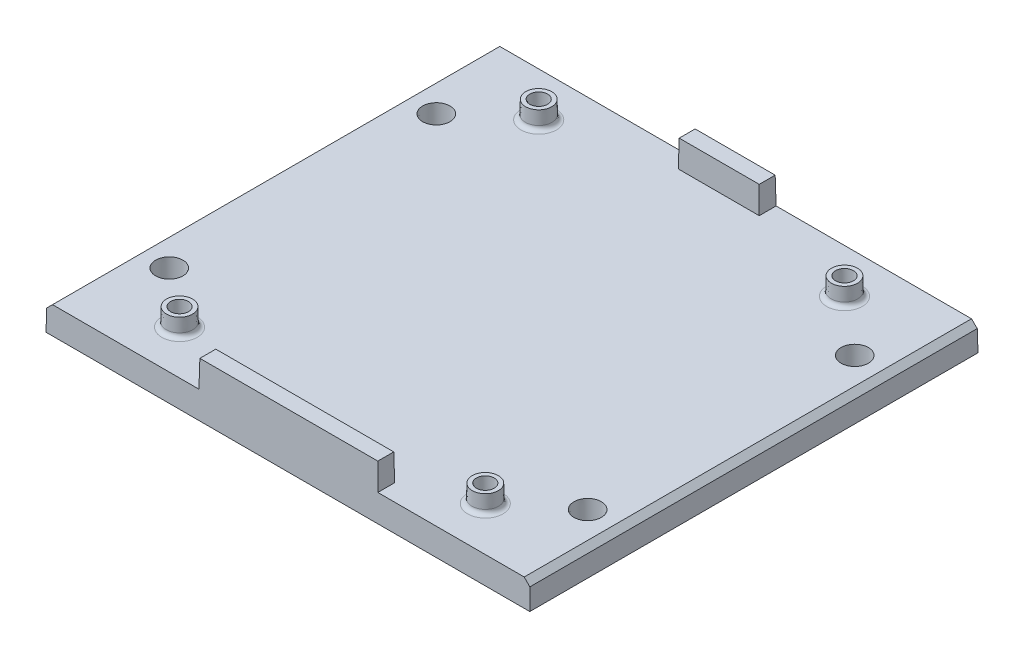
from build123d import *

# Parameters (mm, degrees)
SKETCH1_W                     = 54.349101298
SKETCH1_H                     = 50.349101298
BOSS_EXTRUDE2_DEPTH           = 3
SKETCH7_R                     = 1.53491013
CUT_EXTRUDE1_DEPTH            = 77.127621628
CUT_EXTRUDE1_DRAFT            = -1
CUT_EXTRUDE1_PROFILE_2_DEPTH  = 77.127621628
CUT_EXTRUDE1_PROFILE_2_DRAFT  = -1
CUT_EXTRUDE1_PROFILE_3_DEPTH  = 77.127621628
CUT_EXTRUDE1_PROFILE_3_DRAFT  = -1
CUT_EXTRUDE1_PROFILE_4_DEPTH  = 77.127621628
CUT_EXTRUDE1_PROFILE_4_DRAFT  = -1
SKETCH8_W                     = 20.2
SKETCH8_H                     = 2
SKETCH8_W_2                   = 9.2
BOSS_EXTRUDE3_DEPTH           = 3
FILLET1_SIZE                  = 0.68
SKETCH9_R                     = 1.5
BOSS_EXTRUDE4_DEPTH           = 2
BOSS_EXTRUDE4_DRAFT           = 1
BOSS_EXTRUDE4_PROFILE_2_DEPTH = 2
BOSS_EXTRUDE4_PROFILE_2_DRAFT = 1
BOSS_EXTRUDE4_PROFILE_3_DEPTH = 2
BOSS_EXTRUDE4_PROFILE_3_DRAFT = 1
BOSS_EXTRUDE4_PROFILE_4_DEPTH = 2
BOSS_EXTRUDE4_PROFILE_4_DRAFT = 1
SKETCH10_R                    = 1
CUT_EXTRUDE2_DEPTH            = 3
CUT_EXTRUDE2_DRAFT            = -1
CUT_EXTRUDE2_PROFILE_2_DEPTH  = 3
CUT_EXTRUDE2_PROFILE_2_DRAFT  = -1
CUT_EXTRUDE2_PROFILE_3_DEPTH  = 3
CUT_EXTRUDE2_PROFILE_3_DRAFT  = -1
CUT_EXTRUDE2_PROFILE_4_DEPTH  = 3
CUT_EXTRUDE2_PROFILE_4_DRAFT  = -1
FILLET2_R                     = 0.5
DRAFT1_ANGLE                  = -1


with BuildPart() as part:
    # Sketch1 → Boss-Extrude2 (new body)
    with BuildSketch(Plane(origin=(0, 0, 0), x_dir=(-1, 0, 0), z_dir=(0, -1, 0))):
        with Locations((-30, 25)):
            Rectangle(SKETCH1_W, SKETCH1_H)
    extrude(amount=-BOSS_EXTRUDE2_DEPTH)


with BuildPart() as cut_extrude1_tool:
    # Sketch7 → Cut-Extrude1 (with draft: the straight prism first)
    with BuildSketch(Plane(origin=(0, 3, 0), x_dir=(1, 0, 0), z_dir=(0, 1, 0))):
        with Locations((6.5, 40)):
            Circle(SKETCH7_R)
    extrude(amount=-CUT_EXTRUDE1_DEPTH)
    # Cut-Extrude1: the draft: its side faces are tilted about the plane it starts from
    cut_extrude1_sides = [cut_extrude1_tool.faces().sort_by_distance(p)[0] for p in [
        (4.96508987, -35.563810814, -40),
    ]]
    draft(cut_extrude1_sides, Plane(origin=(0, 3, 0), x_dir=(1, 0, 0), z_dir=(0, 1, 0)), CUT_EXTRUDE1_DRAFT)


with BuildPart() as part_1:
    add(part.part)

    # Cut-Extrude1: cut by cut_extrude1_tool
    add(cut_extrude1_tool.part, mode=Mode.SUBTRACT)


with BuildPart() as cut_extrude1_profile_2_tool:
    # Sketch7 → Cut-Extrude1 profile 2 (with draft: the straight prism first)
    with BuildSketch(Plane(origin=(0, 3, 0), x_dir=(1, 0, 0), z_dir=(0, 1, 0))):
        with Locations((6.5, 10)):
            Circle(SKETCH7_R)
    extrude(amount=-CUT_EXTRUDE1_PROFILE_2_DEPTH)
    # Cut-Extrude1 profile 2: the draft: its side faces are tilted about the plane it starts from
    cut_extrude1_profile_2_sides = [cut_extrude1_profile_2_tool.faces().sort_by_distance(p)[0] for p in [
        (4.96508987, -35.563810814, -10),
    ]]
    draft(cut_extrude1_profile_2_sides, Plane(origin=(0, 3, 0), x_dir=(1, 0, 0), z_dir=(0, 1, 0)), CUT_EXTRUDE1_PROFILE_2_DRAFT)


with BuildPart() as part_2:
    add(part_1.part)

    # Cut-Extrude1 profile 2: cut by cut_extrude1_profile_2_tool
    add(cut_extrude1_profile_2_tool.part, mode=Mode.SUBTRACT)


with BuildPart() as cut_extrude1_profile_3_tool:
    # Sketch7 → Cut-Extrude1 profile 3 (with draft: the straight prism first)
    with BuildSketch(Plane(origin=(0, 3, 0), x_dir=(1, 0, 0), z_dir=(0, 1, 0))):
        with Locations((53.5, 10)):
            Circle(SKETCH7_R)
    extrude(amount=-CUT_EXTRUDE1_PROFILE_3_DEPTH)
    # Cut-Extrude1 profile 3: the draft: its side faces are tilted about the plane it starts from
    cut_extrude1_profile_3_sides = [cut_extrude1_profile_3_tool.faces().sort_by_distance(p)[0] for p in [
        (51.96508987, -35.563810814, -10),
    ]]
    draft(cut_extrude1_profile_3_sides, Plane(origin=(0, 3, 0), x_dir=(1, 0, 0), z_dir=(0, 1, 0)), CUT_EXTRUDE1_PROFILE_3_DRAFT)


with BuildPart() as part_3:
    add(part_2.part)

    # Cut-Extrude1 profile 3: cut by cut_extrude1_profile_3_tool
    add(cut_extrude1_profile_3_tool.part, mode=Mode.SUBTRACT)


with BuildPart() as cut_extrude1_profile_4_tool:
    # Sketch7 → Cut-Extrude1 profile 4 (with draft: the straight prism first)
    with BuildSketch(Plane(origin=(0, 3, 0), x_dir=(1, 0, 0), z_dir=(0, 1, 0))):
        with Locations((53.5, 40)):
            Circle(SKETCH7_R)
    extrude(amount=-CUT_EXTRUDE1_PROFILE_4_DEPTH)
    # Cut-Extrude1 profile 4: the draft: its side faces are tilted about the plane it starts from
    cut_extrude1_profile_4_sides = [cut_extrude1_profile_4_tool.faces().sort_by_distance(p)[0] for p in [
        (51.96508987, -35.563810814, -40),
    ]]
    draft(cut_extrude1_profile_4_sides, Plane(origin=(0, 3, 0), x_dir=(1, 0, 0), z_dir=(0, 1, 0)), CUT_EXTRUDE1_PROFILE_4_DRAFT)


with BuildPart() as part_4:
    add(part_3.part)

    # Cut-Extrude1 profile 4: cut by cut_extrude1_profile_4_tool
    add(cut_extrude1_profile_4_tool.part, mode=Mode.SUBTRACT)

    # Sketch8 → Boss-Extrude3 (add)
    with BuildSketch(Plane(origin=(0, 3, 0), x_dir=(1, 0, 0), z_dir=(0, 1, 0))):
        with Locations((30, 0.825449351)):
            Rectangle(SKETCH8_W, SKETCH8_H)
        with Locations((30, 49.174550649)):
            Rectangle(SKETCH8_W_2, SKETCH8_H)
    extrude(amount=BOSS_EXTRUDE3_DEPTH)

    # Fillet1
    fillet1_edges = [part_4.edges().sort_by_distance(p)[0] for p in [
        (57.174550649, 3, -25),
        (2.825449351, 3, -25),
    ]]
    chamfer(fillet1_edges, length=FILLET1_SIZE)


with BuildPart() as boss_extrude4_tool:
    # Sketch9 → Boss-Extrude4 (with draft: the straight prism first)
    with BuildSketch(Plane(origin=(0, 3, 0), x_dir=(1, 0, 0), z_dir=(0, 1, 0))):
        with Locations((12.825449351, 45.174550649)):
            Circle(SKETCH9_R)
    extrude(amount=BOSS_EXTRUDE4_DEPTH)
    # Boss-Extrude4: the draft: its side faces are tilted about the plane it starts from
    boss_extrude4_sides = [boss_extrude4_tool.faces().sort_by_distance(p)[0] for p in [
        (11.325449351, 4, -45.174550649),
    ]]
    draft(boss_extrude4_sides, Plane(origin=(0, 3, 0), x_dir=(1, 0, 0), z_dir=(0, 1, 0)), BOSS_EXTRUDE4_DRAFT)


with BuildPart() as part_5:
    add(part_4.part)

    # Boss-Extrude4: add boss_extrude4_tool
    add(boss_extrude4_tool.part)


with BuildPart() as boss_extrude4_profile_2_tool:
    # Sketch9 → Boss-Extrude4 profile 2 (with draft: the straight prism first)
    with BuildSketch(Plane(origin=(0, 3, 0), x_dir=(1, 0, 0), z_dir=(0, 1, 0))):
        with Locations((47.174550649, 45.174550649)):
            Circle(SKETCH9_R)
    extrude(amount=BOSS_EXTRUDE4_PROFILE_2_DEPTH)
    # Boss-Extrude4 profile 2: the draft: its side faces are tilted about the plane it starts from
    boss_extrude4_profile_2_sides = [boss_extrude4_profile_2_tool.faces().sort_by_distance(p)[0] for p in [
        (45.674550649, 4, -45.174550649),
    ]]
    draft(boss_extrude4_profile_2_sides, Plane(origin=(0, 3, 0), x_dir=(1, 0, 0), z_dir=(0, 1, 0)), BOSS_EXTRUDE4_PROFILE_2_DRAFT)


with BuildPart() as part_6:
    add(part_5.part)

    # Boss-Extrude4 profile 2: add boss_extrude4_profile_2_tool
    add(boss_extrude4_profile_2_tool.part)


with BuildPart() as boss_extrude4_profile_3_tool:
    # Sketch9 → Boss-Extrude4 profile 3 (with draft: the straight prism first)
    with BuildSketch(Plane(origin=(0, 3, 0), x_dir=(1, 0, 0), z_dir=(0, 1, 0))):
        with Locations((12.825449351, 4.825449351)):
            Circle(SKETCH9_R)
    extrude(amount=BOSS_EXTRUDE4_PROFILE_3_DEPTH)
    # Boss-Extrude4 profile 3: the draft: its side faces are tilted about the plane it starts from
    boss_extrude4_profile_3_sides = [boss_extrude4_profile_3_tool.faces().sort_by_distance(p)[0] for p in [
        (11.325449351, 4, -4.825449351),
    ]]
    draft(boss_extrude4_profile_3_sides, Plane(origin=(0, 3, 0), x_dir=(1, 0, 0), z_dir=(0, 1, 0)), BOSS_EXTRUDE4_PROFILE_3_DRAFT)


with BuildPart() as part_7:
    add(part_6.part)

    # Boss-Extrude4 profile 3: add boss_extrude4_profile_3_tool
    add(boss_extrude4_profile_3_tool.part)


with BuildPart() as boss_extrude4_profile_4_tool:
    # Sketch9 → Boss-Extrude4 profile 4 (with draft: the straight prism first)
    with BuildSketch(Plane(origin=(0, 3, 0), x_dir=(1, 0, 0), z_dir=(0, 1, 0))):
        with Locations((47.174550649, 4.825449351)):
            Circle(SKETCH9_R)
    extrude(amount=BOSS_EXTRUDE4_PROFILE_4_DEPTH)
    # Boss-Extrude4 profile 4: the draft: its side faces are tilted about the plane it starts from
    boss_extrude4_profile_4_sides = [boss_extrude4_profile_4_tool.faces().sort_by_distance(p)[0] for p in [
        (45.674550649, 4, -4.825449351),
    ]]
    draft(boss_extrude4_profile_4_sides, Plane(origin=(0, 3, 0), x_dir=(1, 0, 0), z_dir=(0, 1, 0)), BOSS_EXTRUDE4_PROFILE_4_DRAFT)


with BuildPart() as part_8:
    add(part_7.part)

    # Boss-Extrude4 profile 4: add boss_extrude4_profile_4_tool
    add(boss_extrude4_profile_4_tool.part)


with BuildPart() as cut_extrude2_tool:
    # Sketch10 → Cut-Extrude2 (with draft: the straight prism first)
    with BuildSketch(Plane(origin=(0, 5, 0), x_dir=(1, 0, 0), z_dir=(0, 1, 0))):
        with Locations((12.825449351, 45.174550649)):
            Circle(SKETCH10_R)
    extrude(amount=-CUT_EXTRUDE2_DEPTH)
    # Cut-Extrude2: the draft: its side faces are tilted about the plane it starts from
    cut_extrude2_sides = [cut_extrude2_tool.faces().sort_by_distance(p)[0] for p in [
        (11.825449351, 3.5, -45.174550649),
    ]]
    draft(cut_extrude2_sides, Plane(origin=(0, 5, 0), x_dir=(1, 0, 0), z_dir=(0, 1, 0)), CUT_EXTRUDE2_DRAFT)


with BuildPart() as part_9:
    add(part_8.part)

    # Cut-Extrude2: cut by cut_extrude2_tool
    add(cut_extrude2_tool.part, mode=Mode.SUBTRACT)


with BuildPart() as cut_extrude2_profile_2_tool:
    # Sketch10 → Cut-Extrude2 profile 2 (with draft: the straight prism first)
    with BuildSketch(Plane(origin=(0, 5, 0), x_dir=(1, 0, 0), z_dir=(0, 1, 0))):
        with Locations((47.174550649, 45.174550649)):
            Circle(SKETCH10_R)
    extrude(amount=-CUT_EXTRUDE2_PROFILE_2_DEPTH)
    # Cut-Extrude2 profile 2: the draft: its side faces are tilted about the plane it starts from
    cut_extrude2_profile_2_sides = [cut_extrude2_profile_2_tool.faces().sort_by_distance(p)[0] for p in [
        (46.174550649, 3.5, -45.174550649),
    ]]
    draft(cut_extrude2_profile_2_sides, Plane(origin=(0, 5, 0), x_dir=(1, 0, 0), z_dir=(0, 1, 0)), CUT_EXTRUDE2_PROFILE_2_DRAFT)


with BuildPart() as part_10:
    add(part_9.part)

    # Cut-Extrude2 profile 2: cut by cut_extrude2_profile_2_tool
    add(cut_extrude2_profile_2_tool.part, mode=Mode.SUBTRACT)


with BuildPart() as cut_extrude2_profile_3_tool:
    # Sketch10 → Cut-Extrude2 profile 3 (with draft: the straight prism first)
    with BuildSketch(Plane(origin=(0, 5, 0), x_dir=(1, 0, 0), z_dir=(0, 1, 0))):
        with Locations((12.825449351, 4.825449351)):
            Circle(SKETCH10_R)
    extrude(amount=-CUT_EXTRUDE2_PROFILE_3_DEPTH)
    # Cut-Extrude2 profile 3: the draft: its side faces are tilted about the plane it starts from
    cut_extrude2_profile_3_sides = [cut_extrude2_profile_3_tool.faces().sort_by_distance(p)[0] for p in [
        (11.825449351, 3.5, -4.825449351),
    ]]
    draft(cut_extrude2_profile_3_sides, Plane(origin=(0, 5, 0), x_dir=(1, 0, 0), z_dir=(0, 1, 0)), CUT_EXTRUDE2_PROFILE_3_DRAFT)


with BuildPart() as part_11:
    add(part_10.part)

    # Cut-Extrude2 profile 3: cut by cut_extrude2_profile_3_tool
    add(cut_extrude2_profile_3_tool.part, mode=Mode.SUBTRACT)


with BuildPart() as cut_extrude2_profile_4_tool:
    # Sketch10 → Cut-Extrude2 profile 4 (with draft: the straight prism first)
    with BuildSketch(Plane(origin=(0, 5, 0), x_dir=(1, 0, 0), z_dir=(0, 1, 0))):
        with Locations((47.174550649, 4.825449351)):
            Circle(SKETCH10_R)
    extrude(amount=-CUT_EXTRUDE2_PROFILE_4_DEPTH)
    # Cut-Extrude2 profile 4: the draft: its side faces are tilted about the plane it starts from
    cut_extrude2_profile_4_sides = [cut_extrude2_profile_4_tool.faces().sort_by_distance(p)[0] for p in [
        (46.174550649, 3.5, -4.825449351),
    ]]
    draft(cut_extrude2_profile_4_sides, Plane(origin=(0, 5, 0), x_dir=(1, 0, 0), z_dir=(0, 1, 0)), CUT_EXTRUDE2_PROFILE_4_DRAFT)


with BuildPart() as part_12:
    add(part_11.part)

    # Cut-Extrude2 profile 4: cut by cut_extrude2_profile_4_tool
    add(cut_extrude2_profile_4_tool.part, mode=Mode.SUBTRACT)

    # Fillet2
    fillet2_edges = [part_12.edges().sort_by_distance(p)[0] for p in [
        (11.325449351, 3, -45.174550649),
        (45.674550649, 3, -45.174550649),
        (11.325449351, 3, -4.825449351),
        (45.674550649, 3, -4.825449351),
    ]]
    fillet(fillet2_edges, radius=FILLET2_R)

    # Draft1
    draft1_faces = [part_12.faces().sort_by_distance(p)[0] for p in [
        (57.174550649, 1.16, -25),
        (2.825449351, 1.16, -25),
        (25.4, 4.5, -49.174550649),
        (30, 1.932269907, -50.174550649),
        (34.6, 4.5, -49.174550649),
        (30, 4.5, -48.174550649),
        (19.9, 4.5, -0.825449351),
        (40.1, 4.5, -0.825449351),
        (30, 4.5, -1.825449351),
        (30, 2.311933099, 0.174550649),
    ]]
    draft(draft1_faces, Plane(origin=(0, 0, 0), x_dir=(0, 0, -1), z_dir=(0, -1, 0)), DRAFT1_ANGLE)


solid = part_12.part
